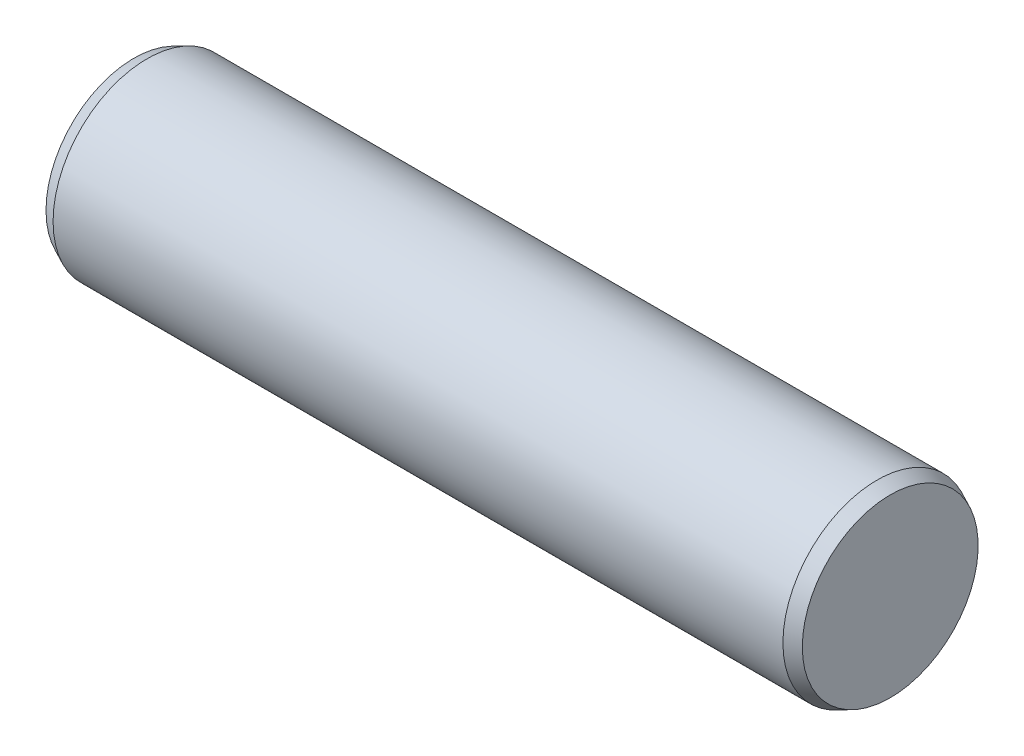
from build123d import *


with BuildPart() as part:
    # Sketch1 → Base-Revolve (revolve)
    with BuildSketch(Plane.XY):
        Polygon((0, 0), (101.6, 0), (101.6, 11.809944984), (99.822, 12.63904), (1.778, 12.63904), (0, 11.809944984), align=None)
    revolve(axis=Axis((-6.35, 0, 0), (1, 0, 0)))


solid = part.part
